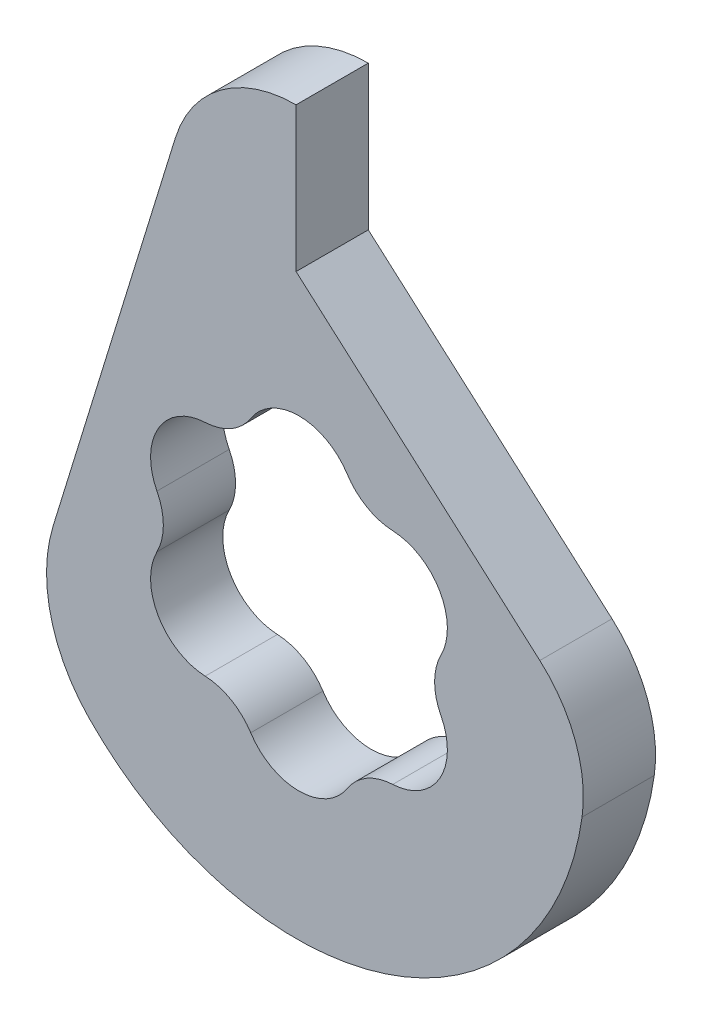
from build123d import *

# Parameters (mm, degrees)
BOSS_EXTRUDE1_DEPTH = 3.175
SKETCH2_R           = 3.175
CUT_EXTRUDE1_DEPTH  = 47.151875985
CUT_EXTRUDE2_DEPTH  = 47.151875985


with BuildPart() as part:
    # Sketch1 → Boss-Extrude1 (new, symmetric)
    with BuildSketch(Plane.XY):
        with BuildLine():
            Line((0, 25.4), (0, 38.1))
            ThreePointArc((0, 38.1), (-6.601808743, 35.926391294), (-10.620985503, 30.255882353))
            Line((-10.620985503, 30.255882353), (-21.359956091, -4.641641441))
            ThreePointArc((-21.359956091, -4.641641441), (-21.576638702, -11.602844718), (-18.214972852, -17.702394302))
            ThreePointArc((-18.214972852, -17.702394302), (7.869396347, -24.150209132), (25.147489087, -3.572645044))
            ThreePointArc((25.147489087, -3.572645044), (24.560785527, 1.932492739), (21.43125, 6.499414072))
            Line((21.43125, 6.499414072), (0, 25.4))
        make_face()
    extrude(amount=BOSS_EXTRUDE1_DEPTH, both=True)

    # Sketch2 → Cut-Extrude1 (cut, through all)
    with BuildSketch(Plane.XY.offset(3.175)):
        with Locations((0.254, 0.254)):
            Circle(SKETCH2_R)
    extrude(amount=-CUT_EXTRUDE1_DEPTH, mode=Mode.SUBTRACT)

    # Sketch3 → Cut-Extrude2 (cut, through all)
    with BuildSketch(Plane.XY.offset(3.175)):
        with BuildLine():
            ThreePointArc((-7.991621344, 9.913178467), (-5.709473161, 10.583038504), (-3.98828326, 12.224506787))
            ThreePointArc((-3.98828326, 12.224506787), (0.254, 14.5415), (4.49628326, 12.224506787))
            ThreePointArc((4.49628326, 12.224506787), (6.217473161, 10.583038504), (8.499621344, 9.913178467))
            ThreePointArc((8.499621344, 9.913178467), (12.627337957, 7.39775), (12.741904604, 2.565328321))
            ThreePointArc((12.741904604, 2.565328321), (12.180946322, 0.254), (12.741904604, -2.057328321))
            ThreePointArc((12.741904604, -2.057328321), (12.627337957, -6.88975), (8.499621344, -9.405178467))
            ThreePointArc((8.499621344, -9.405178467), (6.217473161, -10.075038504), (4.49628326, -11.716506787))
            ThreePointArc((4.49628326, -11.716506787), (0.254, -14.0335), (-3.98828326, -11.716506787))
            ThreePointArc((-3.98828326, -11.716506787), (-5.709473161, -10.075038504), (-7.991621344, -9.405178467))
            ThreePointArc((-7.991621344, -9.405178467), (-12.119337957, -6.88975), (-12.233904604, -2.057328321))
            ThreePointArc((-12.233904604, -2.057328321), (-11.672946322, 0.254), (-12.233904604, 2.565328321))
            ThreePointArc((-12.233904604, 2.565328321), (-12.119337957, 7.39775), (-7.991621344, 9.913178467))
        make_face()
    extrude(amount=-CUT_EXTRUDE2_DEPTH, mode=Mode.SUBTRACT)


solid = part.part
